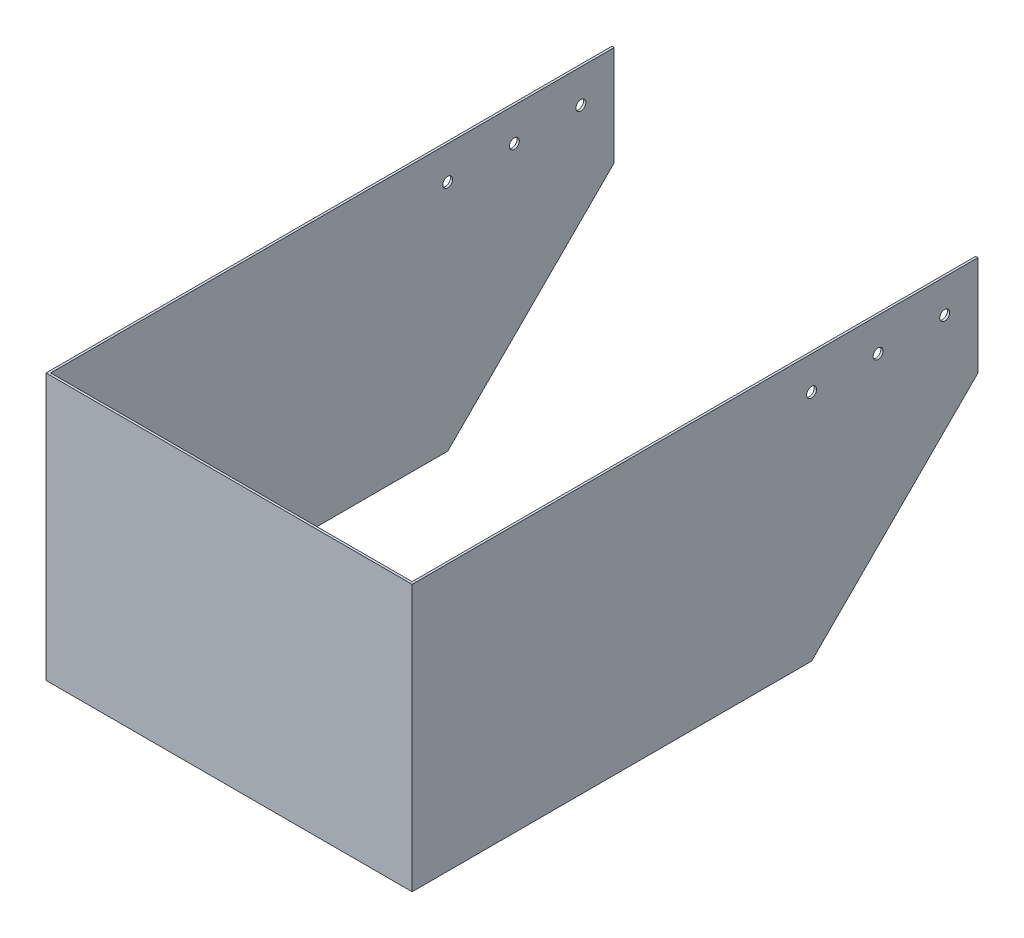
from build123d import *

# Parameters (mm, degrees)
SKETCH1_W           = 110
SKETCH1_H           = 170
BOSS_EXTRUDE1_DEPTH = 80
SKETCH2_W           = 108.6
SKETCH2_H           = 169.3
CUT_EXTRUDE1_DEPTH  = 218.715410571
SKETCH4_R           = 1.5
CUT_EXTRUDE3_DEPTH  = 218.715410571
CUT_EXTRUDE5_DEPTH  = 218.715410571


with BuildPart() as part:
    # Sketch1 → Boss-Extrude1 (new body)
    with BuildSketch(Plane(origin=(0, 0, 0), x_dir=(1, 0, 0), z_dir=(0, 1, 0))):
        with Locations((55, 85)):
            Rectangle(SKETCH1_W, SKETCH1_H)
    extrude(amount=BOSS_EXTRUDE1_DEPTH)

    # Sketch2 → Cut-Extrude1 (cut, through all)
    with BuildSketch(Plane(origin=(0, 80, 0), x_dir=(1, 0, 0), z_dir=(0, 1, 0))):
        with Locations((55, 85.35)):
            Rectangle(SKETCH2_W, SKETCH2_H)
    extrude(amount=-CUT_EXTRUDE1_DEPTH, mode=Mode.SUBTRACT)

    # Sketch4 → Cut-Extrude3 (cut, through all)
    with BuildSketch(Plane(origin=(110, 0, 0), x_dir=(0, 0, -1), z_dir=(1, 0, 0))):
        with Locations((160, 70)):
            Circle(SKETCH4_R)
        with Locations((120, 70)):
            Circle(SKETCH4_R)
        with Locations((140, 70)):
            Circle(SKETCH4_R)
    extrude(amount=-CUT_EXTRUDE3_DEPTH, mode=Mode.SUBTRACT)

    # Sketch8 → Cut-Extrude5 (cut, through all)
    with BuildSketch(Plane(origin=(110, 0, 0), x_dir=(0, 0, -1), z_dir=(1, 0, 0))):
        Polygon((170, 50), (120, 0), (170, 0), align=None)
    extrude(amount=-CUT_EXTRUDE5_DEPTH, mode=Mode.SUBTRACT)


solid = part.part
